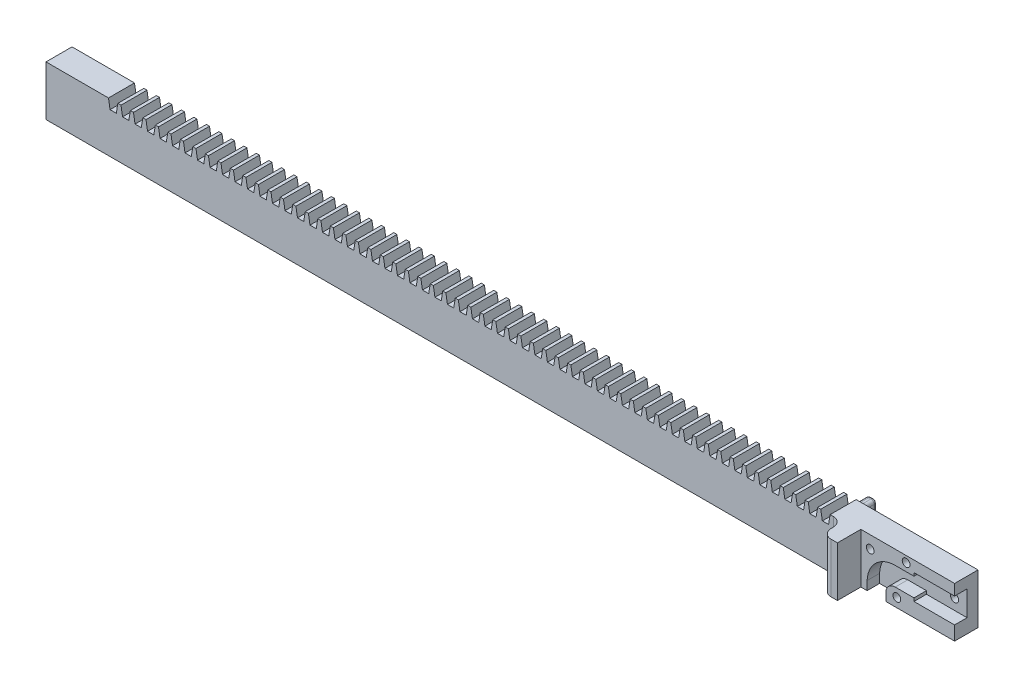
from build123d import *

# Parameters (mm, degrees)
BOSS_EXTRUDE1_DEPTH      = 120
BOSS_EXTRUDE1_DEPTH_BACK = 140
CUT_EXTRUDE1_REACH       = 143.028
LPATTERN1_COUNT          = 58
LPATTERN1_PITCH          = 4
BOSS_EXTRUDE2_DEPTH      = 30
CUT_EXTRUDE2_DEPTH       = 4
M3_TAPPED_HOLE1_D        = 2.5
SKETCH11_W               = 9.147435663
SKETCH11_H               = 21.123596411
CUT_EXTRUDE4_DEPTH       = 255
CUT_EXTRUDE5_REACH       = 152.96
SKETCH12_R               = 1.3
CUT_EXTRUDE6_DEPTH       = 248
FILLET1_R                = 3
SKETCH16_W               = 2.7
SKETCH16_H               = 12
BOSS_EXTRUDE3_DEPTH      = 7
FILLET2_R                = 3
FILLET3_R                = 1


with BuildPart() as part:
    # Sketch1 → Boss-Extrude1 (new, two sides: drawn at the far end of the back side and taken through both)
    with BuildSketch(Plane(origin=(0, 0, 0), x_dir=(0, 0, -1), z_dir=(1, 0, 0)).offset(-BOSS_EXTRUDE1_DEPTH_BACK)):
        Polygon((7.5, -8), (7.5, 8), (-7.5, 8), (-7.5, -8), (0, -8), (1.5, -8), (2, -6), (4, -6), (4.5, -8), align=None)
    extrude(amount=BOSS_EXTRUDE1_DEPTH + BOSS_EXTRUDE1_DEPTH_BACK)

    # Sketch3 → Cut-Extrude1 (cut, up to next)
    with BuildSketch(Plane.XY.offset(7.5), mode=Mode.PRIVATE) as cut_extrude1_sk1:
        Polygon((-120, 8), (-119.5, 5), (-117.5, 5), (-117, 8), align=None)
    cut_extrude1_tool1 = extrude(cut_extrude1_sk1.sketch, amount=-CUT_EXTRUDE1_REACH, mode=Mode.PRIVATE) & part.part
    cut_extrude1 = cut_extrude1_tool1.solids().sort_by_distance((-118.5, 6.6, 7.5))[0]
    add(cut_extrude1, mode=Mode.SUBTRACT)

    # LPattern1: Cut-Extrude1 ×58
    with Locations(*[(i * LPATTERN1_PITCH, 0, 0) for i in range(1, LPATTERN1_COUNT)]):
        add(cut_extrude1, mode=Mode.SUBTRACT)

    # Sketch5 → Boss-Extrude2 (add)
    with BuildSketch(Plane(origin=(120, 0, 0), x_dir=(0, 0, -1), z_dir=(1, 0, 0))):
        Polygon((7.5, -8), (7.5, 8), (0, 8), (0, -8), (1.5, -8), (2, -6), (4, -6), (4.5, -8), align=None)
        Polygon((1.5, -8), (4.5, -8), (4, -6), (2, -6), align=None)
    extrude(amount=BOSS_EXTRUDE2_DEPTH)

    # Sketch6 → Cut-Extrude2 (cut)
    with BuildSketch(Plane.XY):
        with BuildLine():
            Line((150, -3.5), (137, -3.5))
            Line((137, -3.5), (137, -2.5))
            Line((137, -2.5), (131, -2.5))
            ThreePointArc((131, -2.5), (128.981221698, -3.271766714), (128.00500139, -5.2))
            Line((128.00500139, -5.2), (128.00500139, -8))
            Line((128.00500139, -8), (122.00500139, -8))
            Line((122.00500139, -8), (122.00500139, -5.2))
            ThreePointArc((122.00500139, -5.2), (124.743003916, 0.969157596), (131, 3.5))
            Line((131, 3.5), (137, 3.5))
            Line((137, 3.5), (137, 4.5))
            Line((137, 4.5), (150, 4.5))
            Line((150, 4.5), (150, -3.5))
        make_face()
    extrude(amount=-CUT_EXTRUDE2_DEPTH, mode=Mode.SUBTRACT)

    # M3 Tapped Hole1 (through all)
    with Locations(Plane.XY):
        with Locations((134.5, 6), (131.50500139, -5.1), (123, 4)):
            Hole(M3_TAPPED_HOLE1_D / 2)

    # Sketch11 → Cut-Extrude4 (cut)
    with BuildSketch(Plane.ZY.offset(140)):
        with Locations((5.403741828, -0.557179482)):
            Rectangle(SKETCH11_W, SKETCH11_H)
    extrude(amount=-CUT_EXTRUDE4_DEPTH, mode=Mode.SUBTRACT)

    # Sketch12 → Cut-Extrude5 (cut, up to next)
    with BuildSketch(Plane(origin=(0, 0, -7.5), x_dir=(-1, 0, 0), z_dir=(0, 0, -1)), mode=Mode.PRIVATE) as cut_extrude5_sk1:
        with Locations(Location((-146, 0, 0), (0, 0, 90))):
            Circle(SKETCH12_R)
    cut_extrude5_tool1 = extrude(cut_extrude5_sk1.sketch, amount=-CUT_EXTRUDE5_REACH, mode=Mode.PRIVATE) & part.part
    add(cut_extrude5_tool1.solids().sort_by_distance((146, 0, -7.5))[0], mode=Mode.SUBTRACT)

    # Sketch14 → Cut-Extrude6 (cut)
    with BuildSketch(Plane.ZY.offset(140)):
        Polygon((-7.5, 1.5), (-5.5, 1), (-5.5, -1), (-7.5, -1.5), align=None)
    extrude(amount=-CUT_EXTRUDE6_DEPTH, mode=Mode.SUBTRACT)

    # Fillet1
    fillet1_edges = [part.edges().sort_by_distance(p)[0] for p in [
        (115, 0, 0.830023996),
        (115, 0, 7.5),
    ]]
    fillet(fillet1_edges, radius=FILLET1_R)

    # Sketch16 → Boss-Extrude3 (add)
    with BuildSketch(Plane(origin=(0, 0, -7.5), x_dir=(-1, 0, 0), z_dir=(0, 0, -1))):
        with Locations((-109.35, -1.5)):
            Rectangle(SKETCH16_W, SKETCH16_H)
    extrude(amount=BOSS_EXTRUDE3_DEPTH)

    # Fillet2
    fillet2_edges = [part.edges().sort_by_distance(p)[0] for p in [
        (110.7, -1.5, -7.5),
    ]]
    fillet(fillet2_edges, radius=FILLET2_R)

    # Fillet3
    # the kernel refuses this fillet: 1 mm, written as the material it takes off along each edge
    with BuildSketch(Plane(origin=(109.7, 3.5, -13.5), x_dir=(0, 0, -1), z_dir=(1, 0, 0))) as fillet3_piece_1_section:
        Polygon((0, 0), (FILLET3_R * 1.02, 0), (FILLET3_R * 1.02, FILLET3_R * 1.02), (0, FILLET3_R * 1.02), align=None)
    fillet3_piece_1 = extrude(amount=FILLET3_R * 1.02, mode=Mode.PRIVATE)
    fillet3_piece_1 = fillet3_piece_1 - Plane(origin=(109.7, 3.5, -13.5), x_dir=(0, -0.7071067811865475, 0.7071067811865476), z_dir=(1, 0, 0)) * Sphere(FILLET3_R, mode=Mode.PRIVATE)
    add(fillet3_piece_1, mode=Mode.SUBTRACT)
    with BuildSketch(Plane(origin=(109.7, -6.5, -13.5), x_dir=(1, 0, 0), z_dir=(0, -1, 0))) as fillet3_piece_2_section:
        Polygon((0, 0), (FILLET3_R * 1.02, 0), (FILLET3_R * 1.02, -FILLET3_R * 1.02), (0, -FILLET3_R * 1.02), align=None)
    fillet3_piece_2 = extrude(amount=FILLET3_R * 1.02, mode=Mode.PRIVATE)
    fillet3_piece_2 = fillet3_piece_2 - Plane(origin=(109.7, -6.5, -13.5), x_dir=(-0.7071067811865475, 0, 0.7071067811865475), z_dir=(0, -1, 0)) * Sphere(FILLET3_R, mode=Mode.PRIVATE)
    add(fillet3_piece_2, mode=Mode.SUBTRACT)
    with BuildSketch(Plane(origin=(109, -6.5, -13.5), x_dir=(0, 0, -1), z_dir=(0, -1, 0))) as fillet3_piece_3_section:
        Polygon((0, 0), (FILLET3_R * 1.02, 0), (FILLET3_R * 1.02, -FILLET3_R * 1.02), (0, -FILLET3_R * 1.02), align=None)
    fillet3_piece_3 = extrude(amount=FILLET3_R * 1.02, mode=Mode.PRIVATE)
    fillet3_piece_3 = fillet3_piece_3 - Plane(origin=(109, -6.5, -13.5), x_dir=(0.7071067811865475, 0, 0.7071067811865475), z_dir=(0, -1, 0)) * Sphere(FILLET3_R, mode=Mode.PRIVATE)
    add(fillet3_piece_3, mode=Mode.SUBTRACT)
    with BuildSketch(Plane(origin=(109, 3.5, -13.5), x_dir=(0, 1, 0), z_dir=(0, 0, -1))) as fillet3_piece_4_section:
        Polygon((0, 0), (FILLET3_R * 1.02, 0), (FILLET3_R * 1.02, -FILLET3_R * 1.02), (0, -FILLET3_R * 1.02), align=None)
    fillet3_piece_4 = extrude(amount=FILLET3_R * 1.02, mode=Mode.PRIVATE)
    fillet3_piece_4 = fillet3_piece_4 - Plane(origin=(109, 3.5, -13.5), x_dir=(0.7071067811865475, -0.7071067811865475, 0), z_dir=(0, 0, -1)) * Sphere(FILLET3_R, mode=Mode.PRIVATE)
    add(fillet3_piece_4, mode=Mode.SUBTRACT)
    with BuildSketch(Plane(origin=(110.7, 4.5, -10.5), x_dir=(0, -1, 0), z_dir=(0, 0, -1))) as fillet3_piece_5:
        with BuildLine():
            CenterArc((FILLET3_R, FILLET3_R), FILLET3_R, 180, 90)
            Line((0, FILLET3_R), (0, 0))
            Line((0, 0), (FILLET3_R, 0))
        make_face()
    extrude(amount=3, mode=Mode.SUBTRACT)
    with BuildSketch(Plane(origin=(110.7, -7.5, -10.5), x_dir=(0, 1, 0), z_dir=(0, 0, -1))) as fillet3_piece_6:
        with BuildLine():
            CenterArc((FILLET3_R, -FILLET3_R), FILLET3_R, 90, 90)
            Line((0, -FILLET3_R), (0, 0))
            Line((0, 0), (FILLET3_R, 0))
        make_face()
    extrude(amount=3, mode=Mode.SUBTRACT)
    with BuildSketch(Plane(origin=(108, -7.5, -7.5), x_dir=(0, 1, 0), z_dir=(0, 0, -1)), Plane(origin=(108, 4.5, -7.5), x_dir=(1, 0, 0), z_dir=(0, 0, -1))) as fillet3_piece_7:
        with BuildLine():
            CenterArc((FILLET3_R, FILLET3_R), FILLET3_R, 180, 90)
            Line((0, FILLET3_R), (0, 0))
            Line((0, 0), (FILLET3_R, 0))
        make_face()
    extrude(amount=6, mode=Mode.SUBTRACT)
    with BuildSketch(Plane(origin=(110.7, -6.5, -14.5), x_dir=(0, 0, 1), z_dir=(0, 1, 0))) as fillet3_piece_8:
        with BuildLine():
            CenterArc((FILLET3_R, -FILLET3_R), FILLET3_R, 90, 90)
            Line((0, -FILLET3_R), (0, 0))
            Line((0, 0), (FILLET3_R, 0))
        make_face()
    extrude(amount=10, mode=Mode.SUBTRACT)
    with BuildSketch(Plane(origin=(109, -7.5, -14.5), x_dir=(0, 1, 0), z_dir=(1, 0, 0)), Plane(origin=(109.7, 4.5, -14.5), x_dir=(0, -1, 0), z_dir=(-1, 0, 0))) as fillet3_piece_9:
        with BuildLine():
            CenterArc((FILLET3_R, FILLET3_R), FILLET3_R, 180, 90)
            Line((0, FILLET3_R), (0, 0))
            Line((0, 0), (FILLET3_R, 0))
        make_face()
    extrude(amount=0.7, mode=Mode.SUBTRACT)
    with BuildSketch(Plane(origin=(108, 3.5, -14.5), x_dir=(1, 0, 0), z_dir=(0, -1, 0))) as fillet3_piece_10:
        with BuildLine():
            CenterArc((FILLET3_R, FILLET3_R), FILLET3_R, 180, 90)
            Line((0, FILLET3_R), (0, 0))
            Line((0, 0), (FILLET3_R, 0))
        make_face()
    extrude(amount=10, mode=Mode.SUBTRACT)
    with BuildSketch(Plane(origin=(113.7, -7.5, -10.5), x_dir=(0.7404019062872327, 0, 0.6721644271800107), z_dir=(0.6721644271800107, 0, -0.7404019062872327))) as fillet3_piece_11_section:
        with BuildLine():
            CenterArc((3 + FILLET3_R, -FILLET3_R), FILLET3_R, 90, 90)
            Line((3 + FILLET3_R, 0), (3, 0))
            Line((3, 0), (3, -FILLET3_R))
        make_face()
    fillet3_piece_11 = revolve(axis=Axis((113.7, -7.5, -10.5), (0, -1, 0)), revolution_arc=137.765663079, mode=Mode.PRIVATE)
    fillet3_piece_11 = split(fillet3_piece_11, bisect_by=Plane(origin=(111.554090251, -7.242025989, -7.5), z_dir=(0, 0, -1)), keep=Keep.TOP, mode=Mode.PRIVATE)
    add(fillet3_piece_11, mode=Mode.SUBTRACT)
    with BuildSketch(Plane(origin=(113.7, 4.5, -10.5), x_dir=(0.7404019062872327, 0, 0.6721644271800107), z_dir=(0.6721644271800107, 0, -0.7404019062872327))) as fillet3_piece_12_section:
        with BuildLine():
            CenterArc((3 + FILLET3_R, FILLET3_R), FILLET3_R, 180, 90)
            Line((3 + FILLET3_R, 0), (3, 0))
            Line((3, 0), (3, FILLET3_R))
        make_face()
    fillet3_piece_12 = revolve(axis=Axis((113.7, 4.5, -10.5), (0, -1, 0)), revolution_arc=137.765663079, mode=Mode.PRIVATE)
    fillet3_piece_12 = split(fillet3_piece_12, bisect_by=Plane(origin=(111.55409022, 4.242025933, -7.5), z_dir=(0, 0, -1)), keep=Keep.TOP, mode=Mode.PRIVATE)
    add(fillet3_piece_12, mode=Mode.SUBTRACT)


solid = part.part
